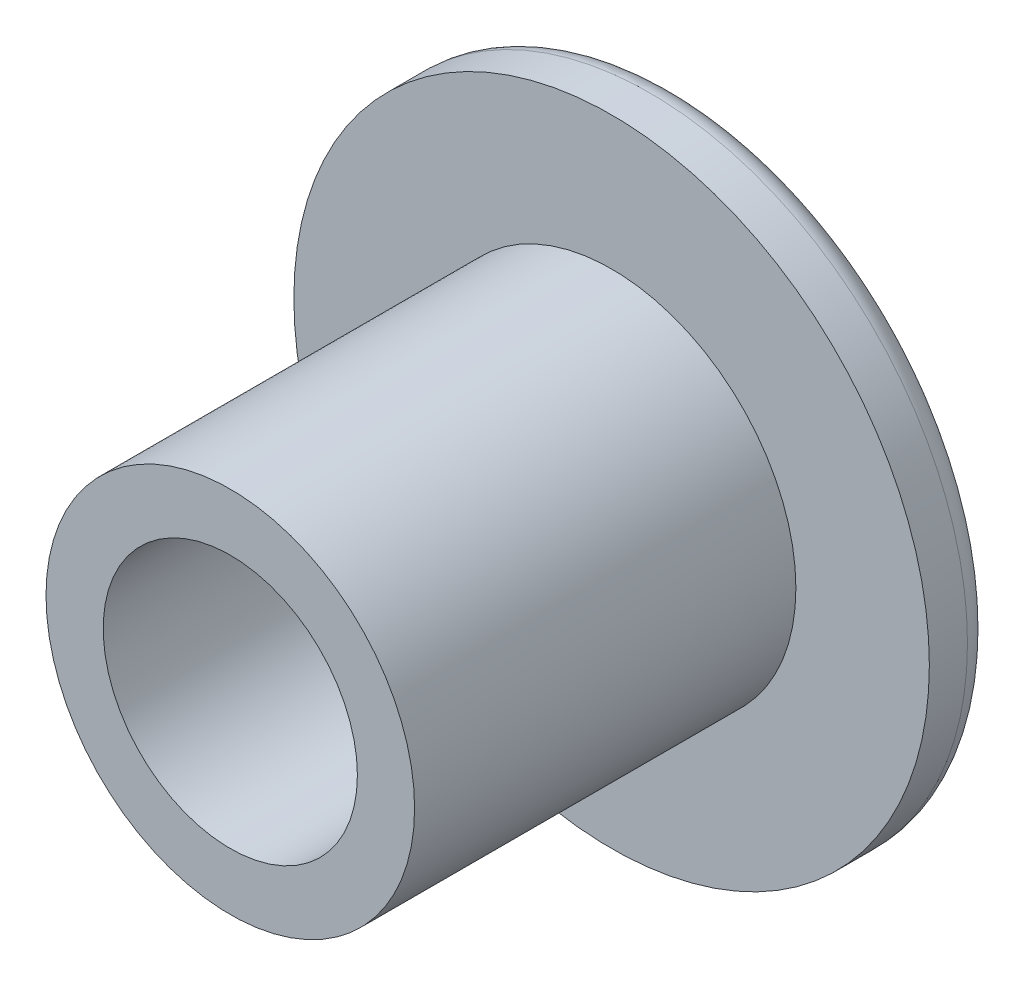
from build123d import *

# Parameters (mm, degrees)
SKETCH1_R               = 5
BOSS_EXTRUDE1_DEPTH     = 1
SKETCH2_R               = 2.9
BOSS_EXTRUDE2_DEPTH     = 6
CUT_EXTRUDE2_DEPTH      = 10.949874371
CUT_EXTRUDE2_DEPTH_BACK = 10.949874371
SKETCH3_R               = 2
FILLET1_R               = 0.4
FILLET2_R               = 0.2


with BuildPart() as part:
    # Sketch1 → Boss-Extrude1 (new body)
    with BuildSketch(Plane.XY):
        Circle(SKETCH1_R)
    extrude(amount=BOSS_EXTRUDE1_DEPTH)

    # Sketch2 → Boss-Extrude2 (add)
    with BuildSketch(Plane.XY.offset(1)):
        Circle(SKETCH2_R)
    extrude(amount=BOSS_EXTRUDE2_DEPTH)

    # Sketch3 → Cut-Extrude2 (cut, two sides: drawn at the far end of the back side and taken through both)
    with BuildSketch(Plane.XY.offset(7).offset(-CUT_EXTRUDE2_DEPTH_BACK)):
        Circle(SKETCH3_R)
    extrude(amount=CUT_EXTRUDE2_DEPTH + CUT_EXTRUDE2_DEPTH_BACK, mode=Mode.SUBTRACT)

    # Fillet1
    fillet1_edges = [part.edges().sort_by_distance(p)[0] for p in [
        (-5, 0, 0),
    ]]
    fillet(fillet1_edges, radius=FILLET1_R)

    # Fillet2
    fillet2_edges = [part.edges().sort_by_distance(p)[0] for p in [
        (-2, 0, 0),
    ]]
    fillet(fillet2_edges, radius=FILLET2_R)


solid = part.part
